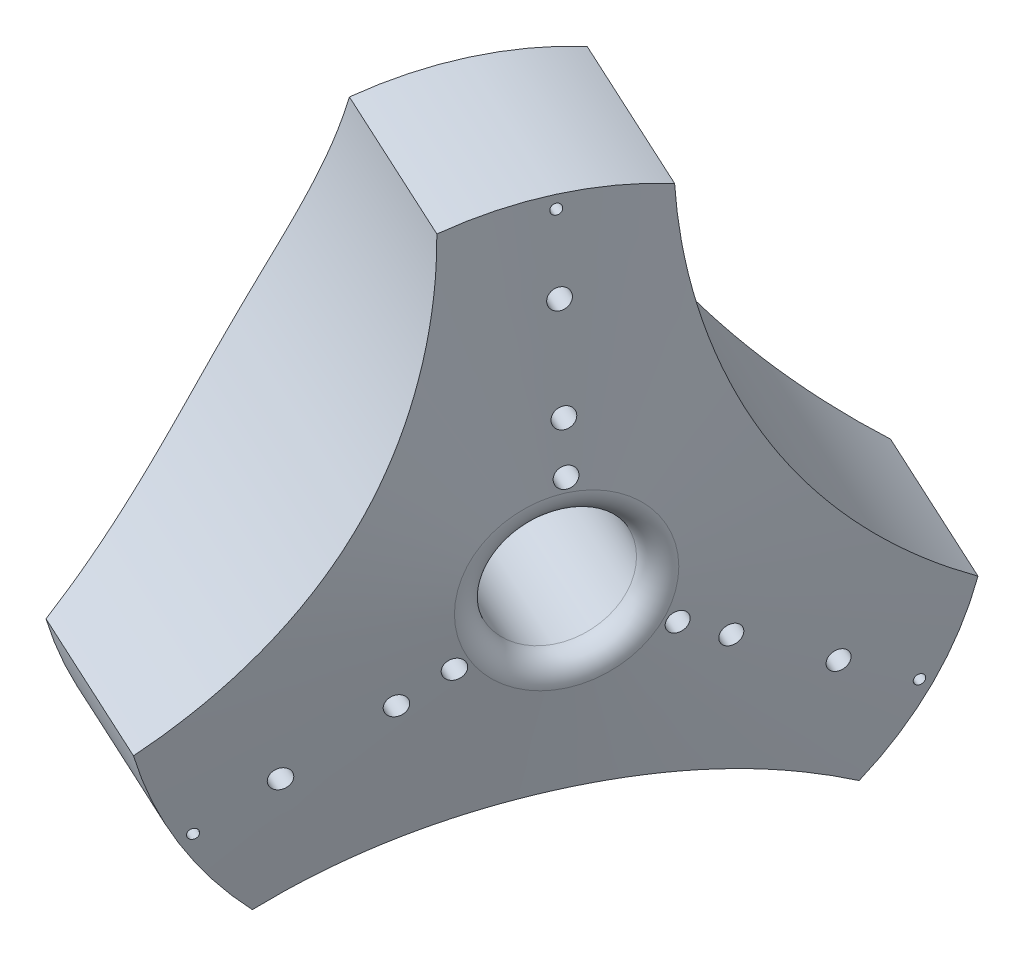
from build123d import *

# Parameters (mm, degrees)
SKETCH_2_R               = 1
SKETCH_2_R_2             = 2
SKETCH_2_R_3             = 98.5
SKETCH_2_R_4             = 12.5
CUT_EXTRUDE_1_DEPTH      = 103
FILLET_1_R               = 4.5
SHELL_1_T                = 2
SKETCH_3_W               = 57.514500212
SKETCH_3_H               = 3.006790225
EXTRUDE_1_DEPTH          = 0.5
PATTERN_CIRCULAR_1_COUNT = 3


with BuildPart() as part:
    # 草图1 → 旋转1 (revolve)
    with BuildSketch(Plane(origin=(0, 0, 0), x_dir=(1, 0, 0), z_dir=(0, 1, 0))):
        Polygon((0, 136.771714706), (0, 73.35401488), (33.441158999, 57.921787545), (62.352465122, 107.99763961), align=None)
    revolve(axis=Axis((0, 0, -147.785155358), (0.9079814669462063, 0, 0.4190103288490815)))

    # 草图2 → 切除-拉伸1 (cut)
    with BuildSketch(Plane(origin=(10.317172099, 0, 4.761112238), x_dir=(0.4190103288490809, 0, -0.9079814669462066), z_dir=(0.9079814669462066, 0, 0.4190103288490809))):
        with Locations((134.186182155, 65.082081502)):
            Circle(SKETCH_2_R)
        with Locations((134.186182155, 50)):
            Circle(SKETCH_2_R_2)
        with Locations((134.186182155, 30)):
            Circle(SKETCH_2_R_2)
        with Locations((134.186182155, 20)):
            Circle(SKETCH_2_R_2)
        with Locations((17.272752644, 67.5)):
            Circle(SKETCH_2_R_3)
        with Locations((251.099611666, 67.5)):
            Circle(SKETCH_2_R_3)
        with Locations((190.548918067, -32.541040751)):
            Circle(SKETCH_2_R)
        with Locations((177.487452344, -25)):
            Circle(SKETCH_2_R_2)
        with Locations((160.166944269, -15)):
            Circle(SKETCH_2_R_2)
        with Locations((151.506690231, -10)):
            Circle(SKETCH_2_R_2)
        with Locations((134.186182155, -135)):
            Circle(SKETCH_2_R_3)
        with Locations((77.823446243, -32.541040751)):
            Circle(SKETCH_2_R)
        with Locations((90.884911966, -25)):
            Circle(SKETCH_2_R_2)
        with Locations((108.205420042, -15)):
            Circle(SKETCH_2_R_2)
        with Locations((116.865674079, -10)):
            Circle(SKETCH_2_R_2)
        with Locations((134.186182155, 0)):
            Circle(SKETCH_2_R_4)
    extrude(amount=-CUT_EXTRUDE_1_DEPTH, mode=Mode.SUBTRACT)

    # 圆角1
    fillet_1_edges = [part.edges().sort_by_distance(p)[0] for p in [
        (66.334872757, 12.499999997, -117.173300535),
    ]]
    fillet(fillet_1_edges, radius=FILLET_1_R)

    # 抽壳1 (no face opened: a closed hollow body)
    add(offset(amount=-SHELL_1_T, mode=Mode.PRIVATE), mode=Mode.SUBTRACT)

    # 草图3 → 凸台-拉伸1 (add, symmetric)
    with BuildSketch(Plane(origin=(56.225396312, 0, -121.838566517), x_dir=(-0.9079814669462065, 0, -0.41901032884908085), z_dir=(0.41901032884908085, -1.6318546229876957e-15, -0.9079814669462065))):
        Polygon((-9.25485764, 16.495909793), (52.558704326, 16.495909793), (53.699088317, 14.083559042), (-9.25485764, 14.083559042), align=None)
        with Locations((20.483699133, 24.871515044)):
            Rectangle(SKETCH_3_W, SKETCH_3_H)
        Polygon((-5.790902834, 53.725899631), (35.246462996, 53.725899631), (31.122254394, 62.450187058), (-5.056218535, 62.450187058), align=None)
    extrude_1 = extrude(amount=EXTRUDE_1_DEPTH, both=True)

    # 阵列(圆周)1: 凸台-拉伸1 ×3 about axis
    pattern_circular_1_axis = Axis((-3.398491632, 0, -149.353472717), (0.9079814669462066, 0, 0.4190103288490806))
    for i in range(1, PATTERN_CIRCULAR_1_COUNT):
        add(extrude_1.rotate(pattern_circular_1_axis, i * 360 / PATTERN_CIRCULAR_1_COUNT))


solid = part.part
